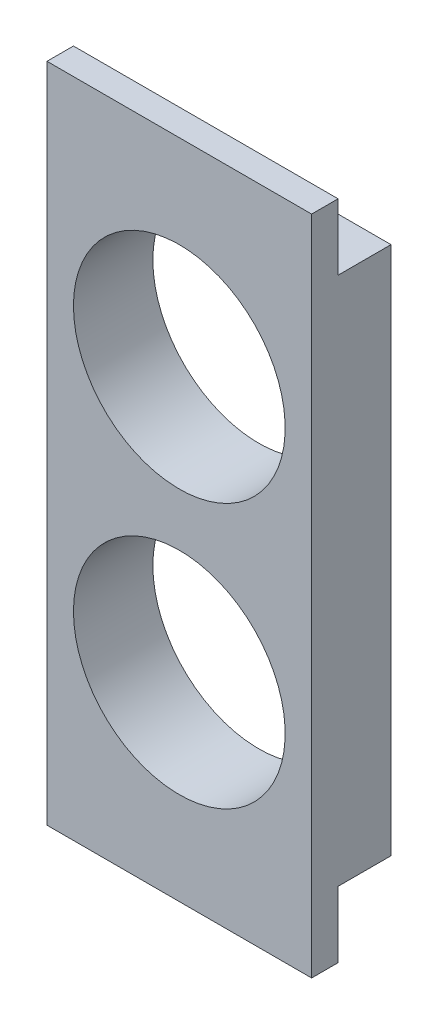
from build123d import *

# Parameters (mm, degrees)
SKETCH_1_W          = 100
SKETCH_1_H          = 200
SKETCH_1_R          = 40
EXTRUDE_1_DEPTH     = 20
SKETCH_2_W          = 100
SKETCH_2_H          = 250
EXTRUDE_2_DEPTH     = 10
SKETCH_3_R          = 40
CUT_EXTRUDE_1_DEPTH = 137.106575888
SKETCH_4_R          = 5
CUT_EXTRUDE_2_DEPTH = 20


with BuildPart() as part:
    # 草图1 → 凸台-拉伸1 (new body)
    with BuildSketch(Plane.XY):
        Rectangle(SKETCH_1_W, SKETCH_1_H)
        with Locations((0, 50)):
            Circle(SKETCH_1_R, mode=Mode.SUBTRACT)
        with Locations((0, -50)):
            Circle(SKETCH_1_R, mode=Mode.SUBTRACT)
    extrude(amount=EXTRUDE_1_DEPTH)

    # 草图2 → 凸台-拉伸2 (add)
    with BuildSketch(Plane.XY.offset(20)):
        Rectangle(SKETCH_2_W, SKETCH_2_H)
    extrude(amount=EXTRUDE_2_DEPTH)

    # 草图3 → 切除-拉伸1 (cut, through all)
    with BuildSketch(Plane(origin=(0, 0, 20), x_dir=(-1, 0, 0), z_dir=(0, 0, -1))):
        with Locations((0, 50)):
            Circle(SKETCH_3_R)
        with Locations((0, -50)):
            Circle(SKETCH_3_R)
    extrude(amount=-CUT_EXTRUDE_1_DEPTH, mode=Mode.SUBTRACT)

    # 草图4 → 切除-拉伸2 (cut)
    with BuildSketch(Plane(origin=(0, 100, 0), x_dir=(1, 0, 0), z_dir=(0, 1, 0))):
        with Locations((-40, -10)):
            Circle(SKETCH_4_R)
    extrude(amount=-CUT_EXTRUDE_2_DEPTH, mode=Mode.SUBTRACT)


solid = part.part
